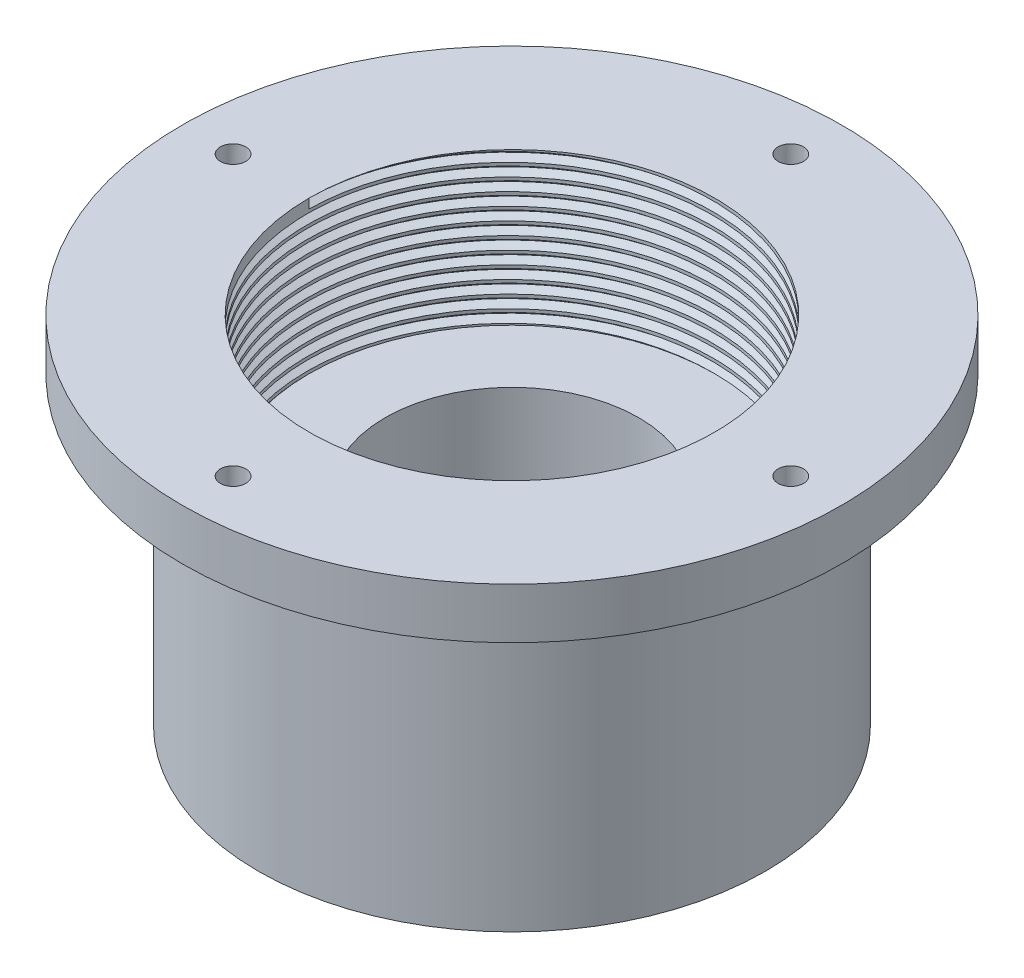
from build123d import *
from build123d.topology import SkipClean

# Parameters (mm, degrees)
SKETCH1_R           = 50
BOSS_EXTRUDE1_DEPTH = 60
SKETCH2_R           = 65
BOSS_EXTRUDE2_DEPTH = 10
SKETCH3_R           = 40
CUT_EXTRUDE1_DEPTH  = 30
SKETCH4_R           = 25
CUT_EXTRUDE2_DEPTH  = 20
SKETCH5_R           = 10
CUT_EXTRUDE4_DEPTH  = 105.642247682
SKETCH6_R           = 2.5
CUT_EXTRUDE5_DEPTH  = 116.542200083
SKETCH7_R           = 2.5
CUT_EXTRUDE6_DEPTH  = 116.542200083
THREAD1_PITCH       = 2.5


with BuildPart() as part:
    # Sketch1 → Boss-Extrude1 (new body)
    with BuildSketch(Plane(origin=(0, 0, 0), x_dir=(1, 0, 0), z_dir=(0, 1, 0))):
        with Locations(Location((0, 0, 0), (0, 0, 270))):
            Circle(SKETCH1_R)
    extrude(amount=BOSS_EXTRUDE1_DEPTH)

    # Sketch2 → Boss-Extrude2 (add)
    with BuildSketch(Plane(origin=(0, 60, 0), x_dir=(1, 0, 0), z_dir=(0, 1, 0))):
        with Locations(Location((0, 0, 0), (0, 0, 270))):
            Circle(SKETCH2_R)
    extrude(amount=BOSS_EXTRUDE2_DEPTH)

    # Sketch3 → Cut-Extrude1 (cut)
    with BuildSketch(Plane(origin=(0, 70, 0), x_dir=(1, 0, 0), z_dir=(0, 1, 0))):
        with Locations(Location((0, 0, 0), (0, 0, 270))):
            Circle(SKETCH3_R)
    extrude(amount=-CUT_EXTRUDE1_DEPTH, mode=Mode.SUBTRACT)

    # Sketch4 → Cut-Extrude2 (cut)
    with BuildSketch(Plane(origin=(0, 40, 0), x_dir=(1, 0, 0), z_dir=(0, 1, 0))):
        with Locations(Location((0, 0, 0), (0, 0, 270))):
            Circle(SKETCH4_R)
    extrude(amount=-CUT_EXTRUDE2_DEPTH, mode=Mode.SUBTRACT)

    # Sketch5 → Cut-Extrude4 (cut, through all)
    with BuildSketch(Plane(origin=(0, 20, 0), x_dir=(1, 0, 0), z_dir=(0, 1, 0))):
        with Locations(Location((0, 0, 0), (0, 0, 270))):
            Circle(SKETCH5_R)
    extrude(amount=-CUT_EXTRUDE4_DEPTH, mode=Mode.SUBTRACT)

    # Sketch6 → Cut-Extrude5 (cut, through all)
    with BuildSketch(Plane(origin=(0, 0, 0), x_dir=(-1, 0, 0), z_dir=(0, -1, 0))):
        with Locations(Location((0, -20, 0), (0, 0, 90))):
            Circle(SKETCH6_R)
        with Locations(Location((-20, 0, 0), (0, 0, 90))):
            Circle(SKETCH6_R)
        with Locations(Location((0, 20, 0), (0, 0, 90))):
            Circle(SKETCH6_R)
        with Locations(Location((20, 0, 0), (0, 0, 90))):
            Circle(SKETCH6_R)
    extrude(amount=-CUT_EXTRUDE5_DEPTH, mode=Mode.SUBTRACT)

    # Sketch7 → Cut-Extrude6 (cut, through all)
    with BuildSketch(Plane(origin=(0, 70, 0), x_dir=(1, 0, 0), z_dir=(0, 1, 0))):
        with Locations(Location((0, 55, 0), (0, 0, 270))):
            Circle(SKETCH7_R)
        with Locations(Location((55, 0, 0), (0, 0, 270))):
            Circle(SKETCH7_R)
        with Locations(Location((0, -55, 0), (0, 0, 270))):
            Circle(SKETCH7_R)
        with Locations(Location((-55, 0, 0), (0, 0, 270))):
            Circle(SKETCH7_R)
    extrude(amount=-CUT_EXTRUDE6_DEPTH, mode=Mode.SUBTRACT)

    # Thread1: the profile of Thread Profile1 profile screwed along a right-hand helix of 12 turns, 10 arcs to a turn; built about Z, then put on its axis
    with SkipClean():  # the faces are left unmerged after this step: merging them gives an invalid solid
        thread1_z = Axis((0, 0, 0), (0, 0, 1))
        thread1_corners = [(39.9997, 0, -0.000173205), (41.353164687, 0, 0.781249997), (41.353164687, 0, 1.093749997), (39.9997, 0, 1.875173198)]
        with BuildLine(mode=Mode.PRIVATE) as thread1_profile:
            Line(thread1_corners[0], thread1_corners[1])
            Line(thread1_corners[1], thread1_corners[2])
            Line(thread1_corners[2], thread1_corners[3])
            Line(thread1_corners[3], thread1_corners[0])
        thread1_cap = Face(thread1_profile.wire())
        thread1_turn_angles = [0, 18, 36, 54, 72, 90, 108, 126, 144, 162, 180, 198, 216, 234, 252, 270, 288, 306, 324, 342, 360]
        thread1_turn_weights = [1, 0.9510565162951535, 1, 0.9510565162951535, 1, 0.9510565162951535, 1, 0.9510565162951535, 1, 0.9510565162951535, 1, 0.9510565162951535, 1, 0.9510565162951535, 1, 0.9510565162951535, 1, 0.9510565162951535, 1, 0.9510565162951535, 1]
        thread1_turn_rails = [Edge.make_bspline([Vector(p[0], p[1], 0).rotate(thread1_z, thread1_turn_angles[k]) / thread1_turn_weights[k] + Vector(0, 0, p[2] + THREAD1_PITCH * thread1_turn_angles[k] / 360) for k in range(21)], [0, 0, 0, 1, 1, 2, 2, 3, 3, 4, 4, 5, 5, 6, 6, 7, 7, 8, 8, 9, 9, 10, 10, 10], 2, thread1_turn_weights) for p in thread1_corners]
        thread1_turn_sides = [Face.make_surface_from_curves(thread1_turn_rails[p[0]], thread1_turn_rails[p[1]]) for p in [(0, 1), (1, 2), (2, 3), (3, 0)]]
        thread1 = Plane(origin=(0, 70, 0), x_dir=(-1, 0, 0), z_dir=(0, -1, 0)) * Solid(Shell([*[p.moved(Location((0, 0, THREAD1_PITCH * i))) for i in range(12) for p in thread1_turn_sides], thread1_cap, thread1_cap.rotate(thread1_z, 4320).moved(Location((0, 0, THREAD1_PITCH * 4320 / 360)))]))
        add(thread1, mode=Mode.SUBTRACT)


solid = part.part
